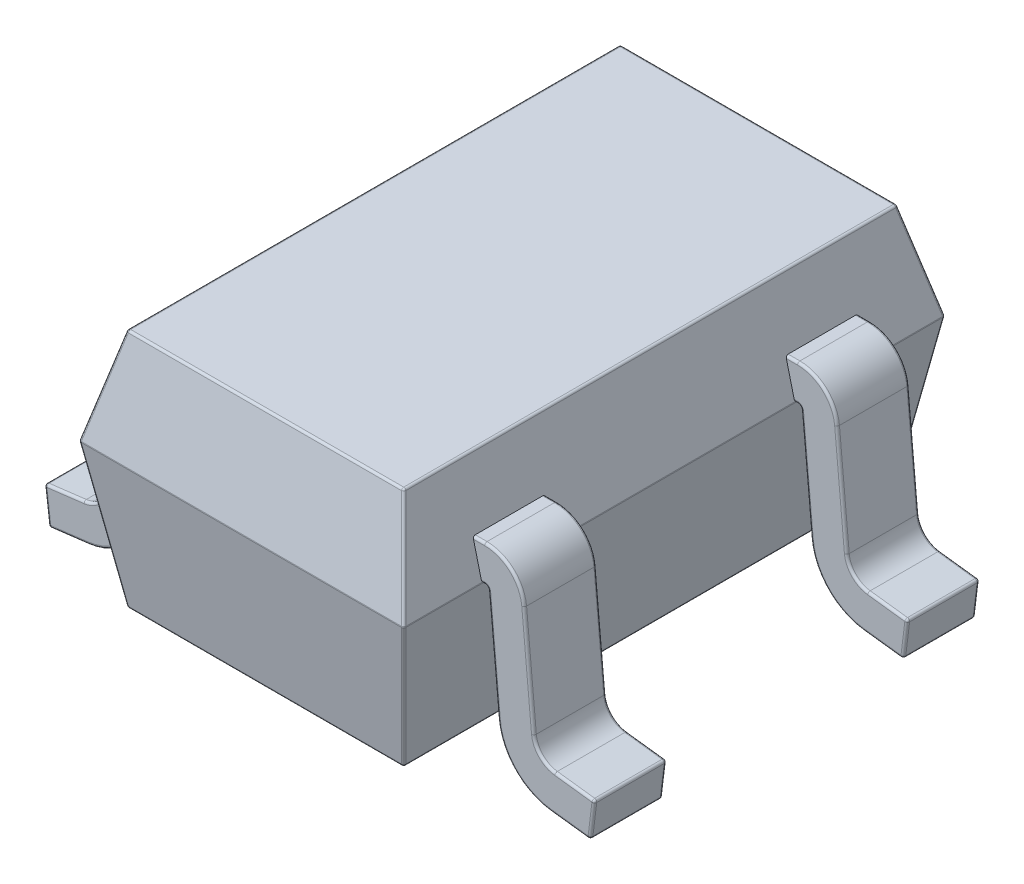
from build123d import *

# Parameters (mm, degrees)
EXTRUDE_1_DEPTH          = 1.125
EXTRUDE_1_DEPTH_BACK     = 1.125
EXTRUDE_2_DEPTH          = 0.15
EXTRUDE_2_DEPTH_BACK     = 0.15
FILLET_1_R               = 0.01
PATTERN_LINEAR_1_COUNT   = 2
PATTERN_LINEAR_1_PITCH   = 0.65
PATTERN_LINEAR_1_2_COUNT = 2
PATTERN_LINEAR_1_2_PITCH = 0.65
CHAMFER_1_SIZE           = 0.4
CHAMFER_1_SIZE2          = 0.1
CHAMFER_2_SIZE           = 0.6
CHAMFER_2_SIZE_2         = 0.1
CHAMFER_3_SIZE           = 0.1
CHAMFER_3_SIZE2          = 0.4
CHAMFER_4_SIZE           = 0.6
CHAMFER_4_SIZE_2         = 0.1
FILLET_2_R               = 0.01


with BuildPart() as part:
    # Эскиз1 → Бобышка-Вытянуть1 (new, two sides: drawn at the far end of the back side and taken through both)
    with BuildSketch(Plane.XY.offset(-EXTRUDE_1_DEPTH_BACK)):
        Polygon((-0.675, 0.7), (-0.575, 1.1), (0.575, 1.1), (0.675, 0.7), (0.575, 0.1), (-0.575, 0.1), align=None)
    extrude(amount=EXTRUDE_1_DEPTH + EXTRUDE_1_DEPTH_BACK)

    # Фаска1
    chamfer_1_edges = [part.edges().sort_by_distance(p)[0] for p in [
        (0, 1.1, 1.125),
    ]]
    chamfer_1_side = [part.faces().sort_by_distance(p)[0] for p in [
        (0, 0.602666667, 1.125),
    ]]
    chamfer(chamfer_1_edges, length=CHAMFER_1_SIZE, length2=CHAMFER_1_SIZE2, reference=chamfer_1_side[0])

    # Фаска2
    # the kernel refuses this chamfer: 0.6, 0.1 mm, written as the material it takes off along each edge
    with BuildSketch(Plane(origin=(2.134214836, 0.1, 1.125), x_dir=(0, 0.9999799892572381, 0.006326222023777832), z_dir=(-1, 0, 0))) as chamfer_2_piece_1:
        Polygon((CHAMFER_2_SIZE * 0.999979989257, CHAMFER_2_SIZE * 0.00632622202378), (-CHAMFER_2_SIZE_2 * 0.00632622202378, CHAMFER_2_SIZE_2 * 0.999979989257), (0, 0), align=None)
    extrude(amount=4.268429673, mode=Mode.SUBTRACT)

    # Фаска3
    chamfer_3_edges = [part.edges().sort_by_distance(p)[0] for p in [
        (0, 1.1, -1.125),
    ]]
    chamfer_3_side = [part.faces().sort_by_distance(p)[0] for p in [
        (0, 1.1, -0.05),
    ]]
    chamfer(chamfer_3_edges, length=CHAMFER_3_SIZE, length2=CHAMFER_3_SIZE2, reference=chamfer_3_side[0])

    # Фаска4
    # the kernel refuses this chamfer: 0.6, 0.1 mm, written as the material it takes off along each edge
    with BuildSketch(Plane(origin=(2.134214836, 0.1, -1.125), x_dir=(0, 0.9999799892572381, -0.006326222023777832), z_dir=(-1, 0, 0))) as chamfer_4_piece_1:
        Polygon((CHAMFER_4_SIZE * 0.999979989257, -CHAMFER_4_SIZE * 0.00632622202378), (-CHAMFER_4_SIZE_2 * 0.00632622202378, -CHAMFER_4_SIZE_2 * 0.999979989257), (0, 0), align=None)
    extrude(amount=4.268429673, mode=Mode.SUBTRACT)

    # Скругление2
    fillet_2_edges = [part.edges().sort_by_distance(p)[0] for p in [
        (0.675, 0.7, 0),
        (-0.675, 0.7, 0),
        (0, 1.1, 1.025),
        (0.625, 0.9, 1.075),
        (0, 0.7, 1.125),
        (-0.625, 0.9, 1.075),
        (0, 0.1, 1.025),
        (-0.625, 0.4, 1.075),
        (0.625, 0.4, 1.075),
        (0, 0.7, -1.125),
        (0.575, 1.1, 0),
        (0.625, 0.9, -1.075),
        (-0.575, 1.1, 0),
        (0, 1.1, -1.025),
        (-0.625, 0.9, -1.075),
        (-0.575, 0.1, 0),
        (-0.625, 0.4, -1.075),
        (0.575, 0.1, 0),
        (0, 0.1, -1.025),
        (0.625, 0.4, -1.075),
    ]]
    fillet(fillet_2_edges, radius=FILLET_2_R)


with BuildPart() as body_2:
    # Эскиз1<3> → Бобышка-Вытянуть2 (new, two sides: drawn at the far end of the back side and taken through both)
    with BuildSketch(Plane.XY.offset(-EXTRUDE_2_DEPTH_BACK)):
        with BuildLine():
            Line((-0.675, 0.7), (-0.6375, 0.85))
            Line((-0.6375, 0.85), (-0.686316982, 0.85))
            ThreePointArc((-0.686316982, 0.85), (-0.797515422, 0.806901217), (-0.850622743, 0.700120082))
            Line((-0.850622743, 0.700120082), (-0.891198531, 0.259194186))
            ThreePointArc((-0.891198531, 0.259194186), (-0.919000251, 0.198730391), (-0.978590846, 0.169103257))
            Line((-0.978590846, 0.169103257), (-1.143280402, 0.148881923))
            Line((-1.143280402, 0.148881923), (-1.125, 0))
            Line((-1.125, 0), (-0.960310445, 0.020221335))
            ThreePointArc((-0.960310445, 0.020221335), (-0.811333956, 0.094289169), (-0.741829658, 0.245448657))
            Line((-0.741829658, 0.245448657), (-0.701253869, 0.686374553))
            ThreePointArc((-0.701253869, 0.686374553), (-0.696425931, 0.696081929), (-0.686316982, 0.7))
            Line((-0.686316982, 0.7), (-0.675, 0.7))
        make_face()
    extrude(amount=EXTRUDE_2_DEPTH + EXTRUDE_2_DEPTH_BACK)

    # Скругление1
    fillet_1_edges = [body_2.edges().sort_by_distance(p)[0] for p in [
        (-1.060935624, 0.15899259, -0.15),
        (-1.134140201, 0.074440961, -0.15),
        (-1.042655222, 0.010110667, -0.15),
        (-1.125, 0, 0),
        (-1.143280402, 0.148881923, 0),
        (-0.811333956, 0.094289169, -0.15),
        (-0.721541763, 0.465911605, -0.15),
        (-1.134140201, 0.074440961, 0.15),
        (-0.696425931, 0.696081929, -0.15),
        (-1.042655222, 0.010110667, 0.15),
        (-0.811333956, 0.094289169, 0.15),
        (-0.721541763, 0.465911605, 0.15),
        (-0.680658491, 0.7, 0.15),
        (-0.797515422, 0.806901217, 0.15),
        (-0.680658491, 0.7, -0.15),
        (-0.870910637, 0.479657134, 0.15),
        (-0.919000251, 0.198730391, 0.15),
        (-1.060935624, 0.15899259, 0.15),
        (-0.696425931, 0.696081929, 0.15),
        (-0.661908491, 0.85, 0.15),
        (-0.661908491, 0.85, -0.15),
        (-0.797515422, 0.806901217, -0.15),
        (-0.870910637, 0.479657134, -0.15),
        (-0.919000251, 0.198730391, -0.15),
    ]]
    fillet(fillet_1_edges, radius=FILLET_1_R)


with BuildPart() as pattern_linear_1_1:
    # Линейный массив1: pattern copy
    add(body_2.part.moved(Location(Vector(0, 0, 1) * (1 * PATTERN_LINEAR_1_PITCH))))


with BuildPart() as pattern_linear_1_2_1:
    # Pattern Linear 1 2: pattern copy
    add(body_2.part.moved(Location(Vector(0, 0, -1) * (1 * PATTERN_LINEAR_1_2_PITCH))))


with BuildPart() as body_5:
    # Зеркальное отражение2: mirrored copy
    add(pattern_linear_1_2_1.part.mirror(Plane(origin=(0, 0, 0), x_dir=(0, 0, 1), z_dir=(1, 0, 0))))


with BuildPart() as body_6:
    # Mirror 2 2: mirrored copy
    add(pattern_linear_1_1.part.mirror(Plane(origin=(0, 0, 0), x_dir=(0, 0, 1), z_dir=(1, 0, 0))))


solid = Compound([part.part, body_2.part, pattern_linear_1_1.part, pattern_linear_1_2_1.part, body_5.part, body_6.part])
